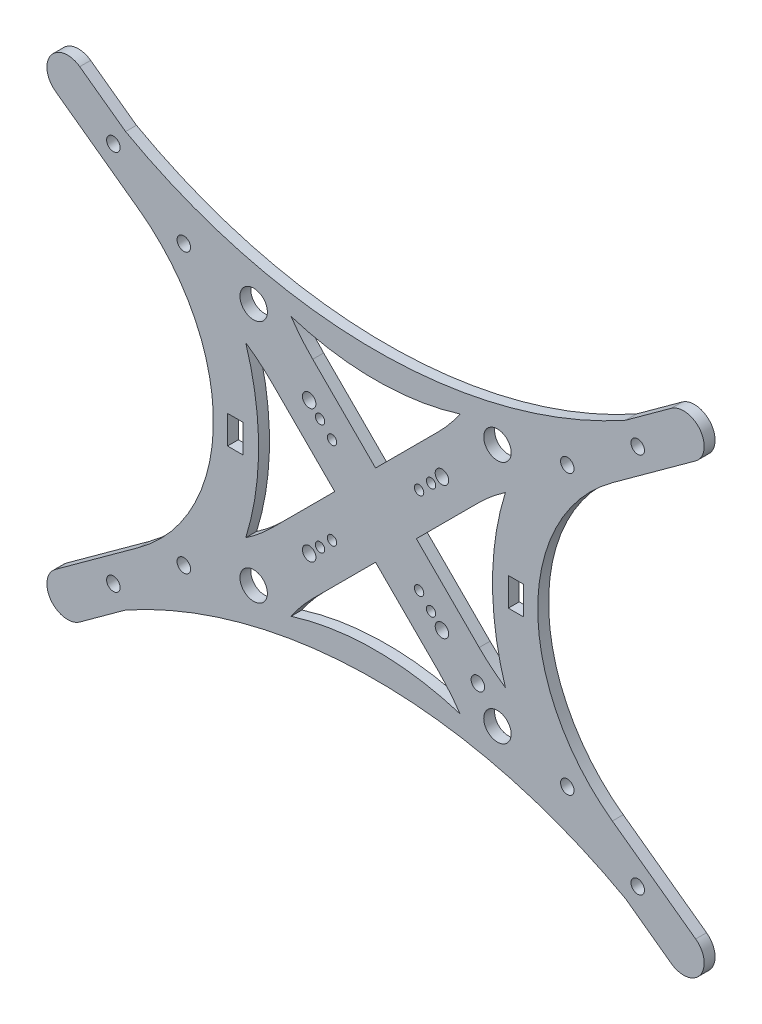
from build123d import *

# Parameters (mm, degrees)
SKETCH_7_R          = 1.075
SKETCH_7_R_2        = 1.55
SKETCH_7_R_3        = 3.15
SKETCH_7_R_4        = 3.150000003
EXTRUDE_2_5_DEPTH   = 2.5
CUT_EXTRUDE_2_DEPTH = 95.113928094
SKETCH_8_W          = 3.5
SKETCH_8_H          = 6.5
CUT_EXTRUDE_3_DEPTH = 95.113928094
PCB_2_R             = 1.55
PCB_DEPTH           = 95.113928094


with BuildPart() as part:
    # 草图7 → 主结构-厚度还是得2.5, 不然铝柱不好选 (new body)
    with BuildSketch(Plane.XY):
        with BuildLine():
            Line((-67.948496874, -55.238795586), (-57.42060576, -47.589834961))
            ThreePointArc((-57.42060576, -47.589834961), (0, -32.757979874), (57.42060576, -47.589834961))
            Line((57.42060576, -47.589834961), (67.948496874, -55.238795586))
            ThreePointArc((67.948496874, -55.238795586), (74.583307546, -54.187944811), (73.532456771, -47.55313414))
            Line((73.532456771, -47.55313414), (54.395000648, -33.648958388))
            ThreePointArc((54.395000648, -33.648958388), (37.25, 0), (54.395000648, 33.648958388))
            Line((54.395000648, 33.648958388), (73.532456771, 47.55313414))
            ThreePointArc((73.532456771, 47.55313414), (74.583307546, 54.187944811), (67.948496874, 55.238795586))
            Line((67.948496874, 55.238795586), (57.42060576, 47.589834961))
            ThreePointArc((57.42060576, 47.589834961), (0, 32.757979874), (-57.42060576, 47.589834961))
            Line((-57.42060576, 47.589834961), (-67.948496874, 55.238795586))
            ThreePointArc((-67.948496874, 55.238795586), (-74.583307546, 54.187944811), (-73.532456771, 47.55313414))
            Line((-73.532456771, 47.55313414), (-54.395000648, 33.648958388))
            ThreePointArc((-54.395000648, 33.648958388), (-37.25, 0), (-54.395000648, -33.648958388))
            Line((-54.395000648, -33.648958388), (-73.532456771, -47.55313414))
            ThreePointArc((-73.532456771, -47.55313414), (-74.583307546, -54.187944811), (-67.948496874, -55.238795586))
        make_face()
        with Locations((10, 10)):
            Circle(SKETCH_7_R, mode=Mode.SUBTRACT)
        with Locations((12.75, 12.75)):
            Circle(SKETCH_7_R, mode=Mode.SUBTRACT)
        with Locations((15.25, 15.25)):
            Circle(SKETCH_7_R_2, mode=Mode.SUBTRACT)
        with Locations((15.25, -15.25)):
            Circle(SKETCH_7_R_2, mode=Mode.SUBTRACT)
        with Locations((12.75, -12.75)):
            Circle(SKETCH_7_R, mode=Mode.SUBTRACT)
        with Locations((10, -10)):
            Circle(SKETCH_7_R, mode=Mode.SUBTRACT)
        with Locations((28, -28)):
            Circle(SKETCH_7_R_3, mode=Mode.SUBTRACT)
        with Locations((28, 28)):
            Circle(SKETCH_7_R_4, mode=Mode.SUBTRACT)
        with Locations((60.224561343, 43.755705046)):
            Circle(SKETCH_7_R_2, mode=Mode.SUBTRACT)
        with Locations((-60.224561343, 43.755705046)):
            Circle(SKETCH_7_R_2, mode=Mode.SUBTRACT)
        with Locations((-28, 28)):
            Circle(SKETCH_7_R_4, mode=Mode.SUBTRACT)
        with Locations((-28, -28)):
            Circle(SKETCH_7_R_3, mode=Mode.SUBTRACT)
        with Locations((-10, -10)):
            Circle(SKETCH_7_R, mode=Mode.SUBTRACT)
        with Locations((-12.75, -12.75)):
            Circle(SKETCH_7_R, mode=Mode.SUBTRACT)
        with Locations((-15.25, -15.25)):
            Circle(SKETCH_7_R_2, mode=Mode.SUBTRACT)
        with Locations((-15.25, 15.25)):
            Circle(SKETCH_7_R_2, mode=Mode.SUBTRACT)
        with Locations((-12.75, 12.75)):
            Circle(SKETCH_7_R, mode=Mode.SUBTRACT)
        with Locations((-10, 10)):
            Circle(SKETCH_7_R, mode=Mode.SUBTRACT)
        with Locations((60.224561343, -43.755705046)):
            Circle(SKETCH_7_R_2, mode=Mode.SUBTRACT)
        with Locations((44.044221455, -32)):
            Circle(SKETCH_7_R_2, mode=Mode.SUBTRACT)
        with Locations((44.044221455, 32)):
            Circle(SKETCH_7_R_2, mode=Mode.SUBTRACT)
        with Locations((-44.044221455, 32)):
            Circle(SKETCH_7_R_2, mode=Mode.SUBTRACT)
        with Locations((-60.224561343, -43.755705046)):
            Circle(SKETCH_7_R_2, mode=Mode.SUBTRACT)
        with Locations((-44.044221455, -32)):
            Circle(SKETCH_7_R_2, mode=Mode.SUBTRACT)
    extrude(amount=EXTRUDE_2_5_DEPTH)

    # 草图6 → 切除-拉伸2 (cut, through all)
    with BuildSketch(Plane.XY):
        with BuildLine():
            Line((-23.801448899, 14.429581723), (-9.371867176, 0))
            Line((-9.371867176, 0), (-23.801448899, -14.429581723))
            ThreePointArc((-23.801448899, -14.429581723), (-26.692624222, -17.058284994), (-29.820182402, -19.400795498))
            ThreePointArc((-29.820182402, -19.400795498), (-26.863678166, 0), (-29.820182402, 19.400795498))
            ThreePointArc((-29.820182402, 19.400795498), (-26.692624222, 17.058284994), (-23.801448899, 14.429581723))
        make_face()
        with BuildLine():
            Line((14.429581723, 23.801448899), (0, 9.371867176))
            Line((0, 9.371867176), (-14.429581723, 23.801448899))
            ThreePointArc((-14.429581723, 23.801448899), (-17.058284994, 26.692624222), (-19.400795498, 29.820182402))
            ThreePointArc((-19.400795498, 29.820182402), (0, 26.863678166), (19.400795498, 29.820182402))
            ThreePointArc((19.400795498, 29.820182402), (17.058284994, 26.692624222), (14.429581723, 23.801448899))
        make_face()
        with BuildLine():
            Line((23.801448899, -14.429581723), (9.371867176, 0))
            Line((9.371867176, 0), (23.801448899, 14.429581723))
            ThreePointArc((23.801448899, 14.429581723), (26.692624222, 17.058284994), (29.820182402, 19.400795498))
            ThreePointArc((29.820182402, 19.400795498), (26.863678166, 0), (29.820182402, -19.400795498))
            ThreePointArc((29.820182402, -19.400795498), (26.692624222, -17.058284994), (23.801448899, -14.429581723))
        make_face()
        with BuildLine():
            Line((-14.429581723, -23.801448899), (0, -9.371867176))
            Line((0, -9.371867176), (14.429581723, -23.801448899))
            ThreePointArc((14.429581723, -23.801448899), (17.058284994, -26.692624222), (19.400795498, -29.820182402))
            ThreePointArc((19.400795498, -29.820182402), (0, -26.863678166), (-19.400795498, -29.820182402))
            ThreePointArc((-19.400795498, -29.820182402), (-17.058284994, -26.692624222), (-14.429581723, -23.801448899))
        make_face()
    extrude(amount=CUT_EXTRUDE_2_DEPTH, mode=Mode.SUBTRACT)

    # 草图8 → 切除-拉伸3 (cut, through all)
    with BuildSketch(Plane.XY):
        with Locations((32.25, 0)):
            Rectangle(SKETCH_8_W, SKETCH_8_H)
        with Locations((-32.25, 0)):
            Rectangle(SKETCH_8_W, SKETCH_8_H)
    extrude(amount=CUT_EXTRUDE_3_DEPTH, mode=Mode.SUBTRACT)

    # PCB 2 → PCB (cut, through all)
    with BuildSketch(Plane.XY):
        with Locations((23.5, -21.71275604)):
            Circle(PCB_2_R)
        with Locations((-29.25, 40.5)):
            Circle(PCB_2_R)
        with Locations((-17.5, -47.5)):
            Circle(PCB_2_R)
        with Locations((29.25, 40.5)):
            Circle(PCB_2_R)
        with Locations((17.5, -47.5)):
            Circle(PCB_2_R)
    extrude(amount=PCB_DEPTH, mode=Mode.SUBTRACT)


solid = part.part
